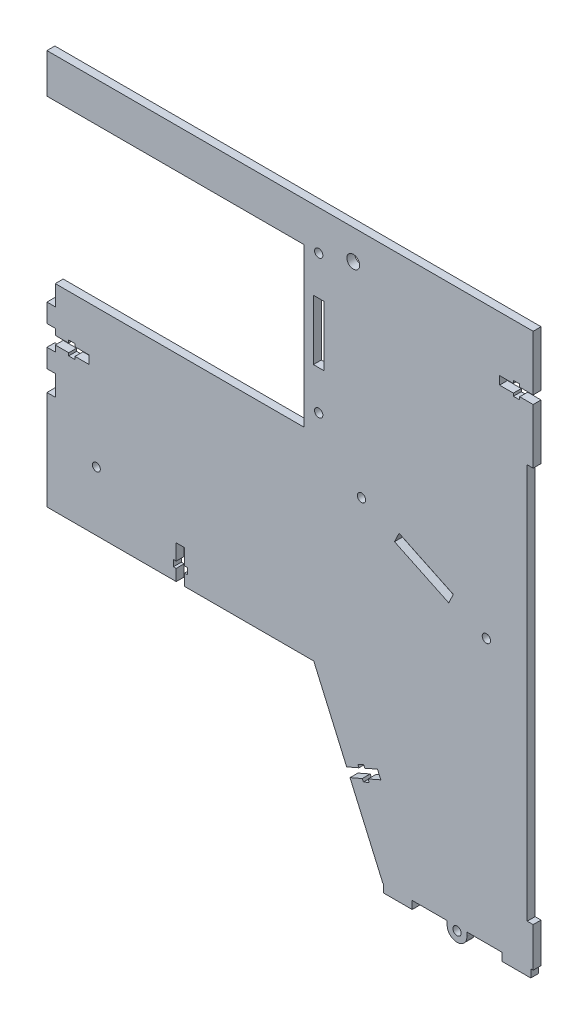
from build123d import *

# Parameters (mm, degrees)
BOSS_EXTRU_1_DEPTH       = 4
ESQUISSE2_W              = 130
ESQUISSE2_H              = 80
ENL_V_MAT_EXTRU_1_DEPTH  = 242.33172191
ESQUISSE3_W              = 3
ESQUISSE3_H              = 200
ENL_V_MAT_EXTRU_2_DEPTH  = 242.33172191
ESQUISSE4_R              = 2.1
ENL_V_MAT_EXTRU_3_DEPTH  = 242.33172191
ESQUISSE5_R              = 2
ENL_V_MAT_EXTRU_4_DEPTH  = 242.33172191
ESQUISSE7_R              = 3.25
ENL_V_MAT_EXTRU_6_DEPTH  = 242.33172191
ESQUISSE8_W              = 5.4
ESQUISSE8_H              = 30.4
ENL_V_MAT_EXTRU_7_DEPTH  = 242.33172191
ESQUISSE9_W              = 4.4
ESQUISSE9_H              = 10.4
ENL_V_MAT_EXTRU_8_DEPTH  = 4.2
ENL_V_MAT_EXTRU_9_DEPTH  = 242.33172191
ESQUISSE12_W             = 14.6
ESQUISSE12_H             = 4
BOSS_EXTRU_2_DEPTH       = 4
ENL_V_MAT_EXTRU_10_DEPTH = 242.33172191
ENL_V_MAT_EXTRU_11_DEPTH = 242.33172191
ENL_V_MAT_EXTRU_12_DEPTH = 242.33172191
ESQUISSE16_R             = 2.1
ENL_V_MAT_EXTRU_13_DEPTH = 242.33172191


with BuildPart() as part:
    # Esquisse1 → Boss.-Extru.1 (new body)
    with BuildSketch(Plane.XY):
        Polygon((0, 0), (-135, 0), (-135, 200), (111, 200), (111, -80), (35, -80), align=None)
    extrude(amount=BOSS_EXTRU_1_DEPTH)

    # Esquisse2 → Enlèv. mat.-Extru.1 (cut, through all)
    with BuildSketch(Plane.XY.offset(4)):
        with Locations((-70, 140)):
            Rectangle(ESQUISSE2_W, ESQUISSE2_H)
    extrude(amount=-ENL_V_MAT_EXTRU_1_DEPTH, mode=Mode.SUBTRACT)

    # Esquisse3 → Enlèv. mat.-Extru.2 (cut, through all)
    with BuildSketch(Plane.XY.offset(4)):
        with Locations((109.5, 40)):
            Rectangle(ESQUISSE3_W, ESQUISSE3_H)
    extrude(amount=-ENL_V_MAT_EXTRU_2_DEPTH, mode=Mode.SUBTRACT)

    # Esquisse4 → Enlèv. mat.-Extru.3 (cut, through all)
    with BuildSketch(Plane.XY.offset(4)):
        with Locations((24.132044328, 83.658479689)):
            Circle(ESQUISSE4_R)
        with Locations((87.332280645, 53.563129062)):
            Circle(ESQUISSE4_R)
        with Locations((2.5, 110)):
            Circle(ESQUISSE4_R)
        with Locations((2.5, 180)):
            Circle(ESQUISSE4_R)
    extrude(amount=-ENL_V_MAT_EXTRU_3_DEPTH, mode=Mode.SUBTRACT)

    # Esquisse5 → Enlèv. mat.-Extru.4 (cut, through all)
    with BuildSketch(Plane.XY.offset(4)):
        with Locations((-110, 30)):
            Circle(ESQUISSE5_R)
    extrude(amount=-ENL_V_MAT_EXTRU_4_DEPTH, mode=Mode.SUBTRACT)

    # Esquisse7 → Enlèv. mat.-Extru.6 (cut, through all)
    with BuildSketch(Plane(origin=(0, 0, 0), x_dir=(-1, 0, 0), z_dir=(0, 0, -1))):
        with Locations((-20, 185)):
            Circle(ESQUISSE7_R)
    extrude(amount=-ENL_V_MAT_EXTRU_6_DEPTH, mode=Mode.SUBTRACT)

    # Esquisse8 → Enlèv. mat.-Extru.7 (cut, through all)
    with BuildSketch(Plane.XY.offset(4)):
        with Locations((2.5, 145)):
            Rectangle(ESQUISSE8_W, ESQUISSE8_H)
        Polygon((68.294821705, 59.638090553), (70.616463039, 64.513537354), (43.169503267, 77.583518198), (40.847861933, 72.708071397), align=None)
    extrude(amount=-ENL_V_MAT_EXTRU_7_DEPTH, mode=Mode.SUBTRACT)

    # Esquisse9 → Enlèv. mat.-Extru.8 (cut)
    with BuildSketch(Plane.ZY.offset(135)):
        with Locations((2, 95)):
            Rectangle(ESQUISSE9_W, ESQUISSE9_H)
        with Locations((2, 55.385186032)):
            Rectangle(ESQUISSE9_W, ESQUISSE9_H)
        with Locations((2, 75.192593016)):
            Rectangle(ESQUISSE9_W, ESQUISSE9_H)
    extrude(amount=-ENL_V_MAT_EXTRU_8_DEPTH, mode=Mode.SUBTRACT)

    # Esquisse10 → Enlèv. mat.-Extru.9 (cut, through all)
    with BuildSketch(Plane.XY.offset(4)):
        Polygon((-130.8, 77.292593016), (-124, 77.292593016), (-124, 78.692593016), (-120.8, 78.692593016), (-120.8, 77.292593016), (-113.8, 77.292593016), (-113.8, 73.092593016), (-120.8, 73.092593016), (-120.8, 71.692593016), (-124, 71.692593016), (-124, 73.092593016), (-130.8, 73.092593016), align=None)
    extrude(amount=-ENL_V_MAT_EXTRU_9_DEPTH, mode=Mode.SUBTRACT)

    # Esquisse12 → Boss.-Extru.2 (add)
    with BuildSketch(Plane(origin=(0, 0, 0), x_dir=(-1, 0, 0), z_dir=(0, 0, -1))):
        with Locations((-42.5, -82)):
            Rectangle(ESQUISSE12_W, ESQUISSE12_H)
        with Locations((-102.5, -82)):
            Rectangle(ESQUISSE12_W, ESQUISSE12_H)
        with BuildLine():
            Line((-67.5, -82), (-67.5, -80))
            Line((-67.5, -80), (-77.5, -80))
            Line((-77.5, -80), (-77.5, -82))
            ThreePointArc((-77.5, -82), (-72.5, -87), (-67.5, -82))
        make_face()
    extrude(amount=-BOSS_EXTRU_2_DEPTH)

    # Esquisse13 → Enlèv. mat.-Extru.10 (cut, through all)
    with BuildSketch(Plane(origin=(0, 0, 0), x_dir=(-1, 0, 0), z_dir=(0, 0, -1))):
        Polygon((-18.341719551, -41.923930403), (-16.658280449, -38.076069597), (-22.888150326, -35.350501525), (-22.327003958, -34.067881257), (-25.25870743, -32.785260988), (-25.819853798, -34.067881257), (-32.232955142, -31.262149418), (-33.916394245, -35.110010225), (-27.5032929, -37.915742063), (-28.064439268, -39.198362332), (-25.132735796, -40.480982601), (-24.571589429, -39.198362332), align=None)
    extrude(amount=-ENL_V_MAT_EXTRU_10_DEPTH, mode=Mode.SUBTRACT)

    # Esquisse14 → Enlèv. mat.-Extru.11 (cut, through all)
    with BuildSketch(Plane(origin=(0, 0, 0), x_dir=(-1, 0, 0), z_dir=(0, 0, -1))):
        Polygon((-104.2, 172.1), (-104.2, 173.5), (-101, 173.5), (-101, 172.1), (-94, 172.1), (-94, 167.9), (-101, 167.9), (-101, 166.5), (-104.2, 166.5), (-104.2, 167.9), (-111, 167.9), (-111, 172.1), align=None)
    extrude(amount=-ENL_V_MAT_EXTRU_11_DEPTH, mode=Mode.SUBTRACT)

    # Esquisse15 → Enlèv. mat.-Extru.12 (cut, through all)
    with BuildSketch(Plane.XY.offset(4)):
        Polygon((-69.6, 17), (-65.4, 17), (-65.4, 9), (-64, 9), (-64, 5.8), (-65.4, 5.8), (-65.4, 0), (-69.6, 0), (-69.6, 5.8), (-71, 5.8), (-71, 9), (-69.6, 9), align=None)
    extrude(amount=-ENL_V_MAT_EXTRU_12_DEPTH, mode=Mode.SUBTRACT)

    # Esquisse16 → Enlèv. mat.-Extru.13 (cut, through all)
    with BuildSketch(Plane.XY.offset(4)):
        with Locations((72.5, -82)):
            Circle(ESQUISSE16_R)
    extrude(amount=-ENL_V_MAT_EXTRU_13_DEPTH, mode=Mode.SUBTRACT)


solid = part.part
